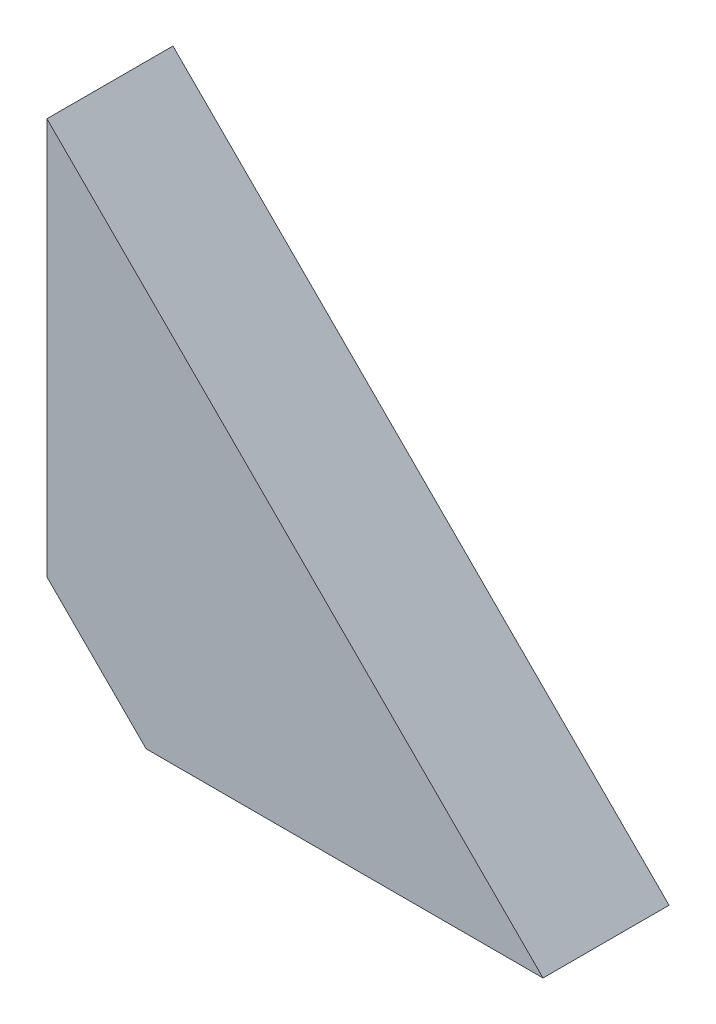
from build123d import *

# Parameters (mm, degrees)
FLANGE_BASE1_DEPTH = 12.7
CHANFRO1_SIZE      = 10


# Sheet-metal steps are written as plain solids
with BuildPart() as part:
    # Esboço1 → Flange-base1 (new body)
    with BuildSketch(Plane.XY):
        Polygon((0, 50), (50, 0), (0, 0), align=None)
    extrude(amount=-FLANGE_BASE1_DEPTH)

    # Chanfro1
    chanfro1_edges = [part.edges().sort_by_distance(p)[0] for p in [
        (0, 0, -6.35),
    ]]
    chamfer(chanfro1_edges, length=CHANFRO1_SIZE)


solid = part.part
